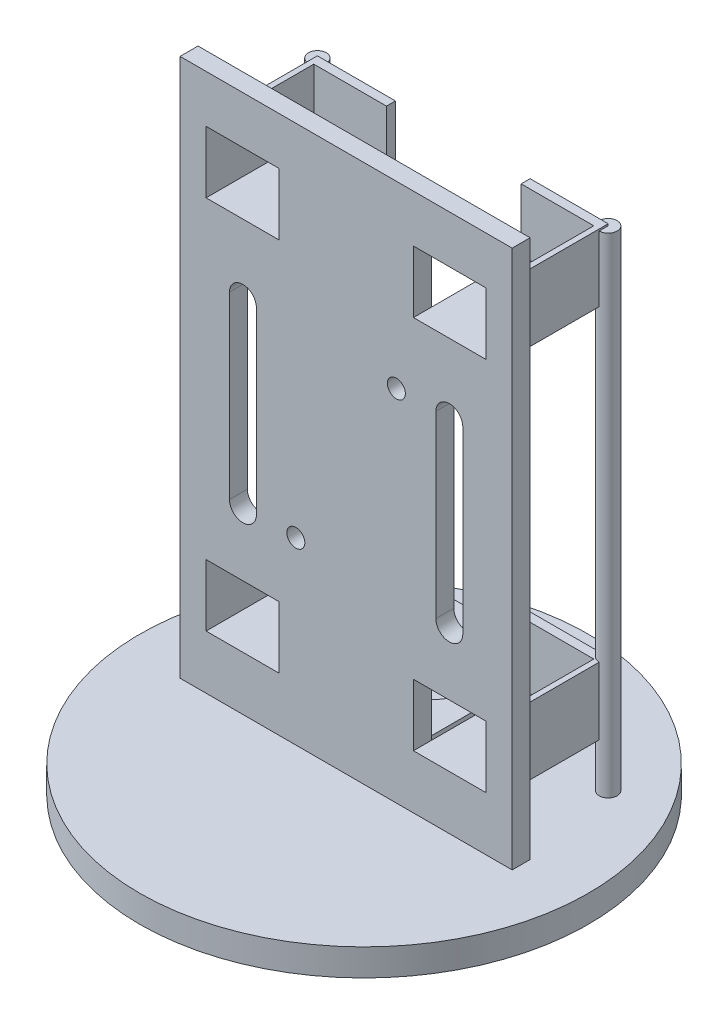
from build123d import *

# Parameters (mm, degrees)
SKETCH1_W           = 93.98
SKETCH1_H           = 152.4
SKETCH1_R           = 2.54
SKETCH1_W_2         = 20.574
SKETCH1_H_2         = 17.526
BOSS_EXTRUDE1_DEPTH = 5.08
BOSS_EXTRUDE2_DEPTH = 27.94
SKETCH4_W           = 22.098
SKETCH4_H           = 19.05
BOSS_EXTRUDE3_DEPTH = 2.54
SKETCH5_R           = 63.5
BOSS_EXTRUDE4_DEPTH = 7.62
SKETCH6_W           = 36.576
SKETCH6_H           = 36.576
SKETCH6_R           = 13.335
BOSS_EXTRUDE5_DEPTH = 15.621
SKETCH8_R           = 2.54
BOSS_EXTRUDE6_DEPTH = 138.43


with BuildPart() as part:
    # Sketch1 → Boss-Extrude1 (new body)
    with BuildSketch(Plane.XY):
        Rectangle(SKETCH1_W, SKETCH1_H)
        with Locations((-14.224, -25.4)):
            Circle(SKETCH1_R, mode=Mode.SUBTRACT)
        with Locations((14.224, 25.4)):
            Circle(SKETCH1_R, mode=Mode.SUBTRACT)
        with Locations((29.337, 53.975)):
            Rectangle(SKETCH1_W_2, SKETCH1_H_2, mode=Mode.SUBTRACT)
        with Locations((-29.337, -52.197)):
            Rectangle(SKETCH1_W_2, SKETCH1_H_2, mode=Mode.SUBTRACT)
        with Locations((-29.337, 53.975)):
            Rectangle(SKETCH1_W_2, SKETCH1_H_2, mode=Mode.SUBTRACT)
        with Locations((29.337, -52.197)):
            Rectangle(SKETCH1_W_2, SKETCH1_H_2, mode=Mode.SUBTRACT)
        with BuildLine():
            Line((-33.02, -25.4), (-33.02, 25.4))
            ThreePointArc((-33.02, 25.4), (-29.21, 29.21), (-25.4, 25.4))
            Line((-25.4, 25.4), (-25.4, -25.4))
            ThreePointArc((-25.4, -25.4), (-29.21, -29.21), (-33.02, -25.4))
        make_face(mode=Mode.SUBTRACT)
        with BuildLine():
            Line((25.4, -25.4), (25.4, 25.4))
            ThreePointArc((25.4, 25.4), (29.21, 29.21), (33.02, 25.4))
            Line((33.02, 25.4), (33.02, -25.4))
            ThreePointArc((33.02, -25.4), (29.21, -29.21), (25.4, -25.4))
        make_face(mode=Mode.SUBTRACT)
    extrude(amount=BOSS_EXTRUDE1_DEPTH)

    # Sketch3 → Boss-Extrude2 (add)
    with BuildSketch(Plane(origin=(0, 0, 0), x_dir=(-1, 0, 0), z_dir=(0, 0, -1))):
        Polygon((-19.05, 45.212), (-39.624, 45.212), (-39.624, 62.738), (-41.148, 62.738), (-41.148, 43.688), (-19.05, 43.688), align=None)
        Polygon((19.05, 45.212), (39.624, 45.212), (39.624, 62.738), (41.148, 62.738), (41.148, 43.688), (19.05, 43.688), align=None)
        Polygon((19.05, -60.96), (39.624, -60.96), (39.624, -43.434), (41.148, -43.434), (41.148, -62.484), (19.05, -62.484), align=None)
        Polygon((-39.624, -43.434), (-39.624, -60.96), (-19.05, -60.96), (-19.05, -62.484), (-41.148, -62.484), (-41.148, -43.434), align=None)
    extrude(amount=BOSS_EXTRUDE2_DEPTH)

    # Sketch4 → Boss-Extrude3 (add)
    with BuildSketch(Plane(origin=(0, 0, -27.94), x_dir=(-1, 0, 0), z_dir=(0, 0, -1))):
        with Locations((-30.099, 53.213)):
            Rectangle(SKETCH4_W, SKETCH4_H)
        with Locations((30.099, 53.213)):
            Rectangle(SKETCH4_W, SKETCH4_H)
        with Locations((30.099, -52.959)):
            Rectangle(SKETCH4_W, SKETCH4_H)
        with Locations((-30.099, -52.959)):
            Rectangle(SKETCH4_W, SKETCH4_H)
    extrude(amount=-BOSS_EXTRUDE3_DEPTH)

    # Sketch5 → Boss-Extrude4 (add)
    with BuildSketch(Plane.XZ.offset(76.2)):
        Circle(SKETCH5_R)
    extrude(amount=BOSS_EXTRUDE4_DEPTH)

    # Sketch6 → Boss-Extrude5 (add)
    with BuildSketch(Plane(origin=(0, -76.2, 0), x_dir=(1, 0, 0), z_dir=(0, 1, 0))):
        with Locations((0, 19.05)):
            Rectangle(SKETCH6_W, SKETCH6_H)
        with Locations((0, 19.05)):
            Circle(SKETCH6_R, mode=Mode.SUBTRACT)
    extrude(amount=BOSS_EXTRUDE5_DEPTH)

    # Sketch8 → Boss-Extrude6 (add)
    with BuildSketch(Plane(origin=(0, -76.2, 0), x_dir=(1, 0, 0), z_dir=(0, 1, 0))):
        with Locations((-41.148, 27.94)):
            Circle(SKETCH8_R)
        with Locations((41.148, 27.94)):
            Circle(SKETCH8_R)
    extrude(amount=BOSS_EXTRUDE6_DEPTH)


solid = part.part
